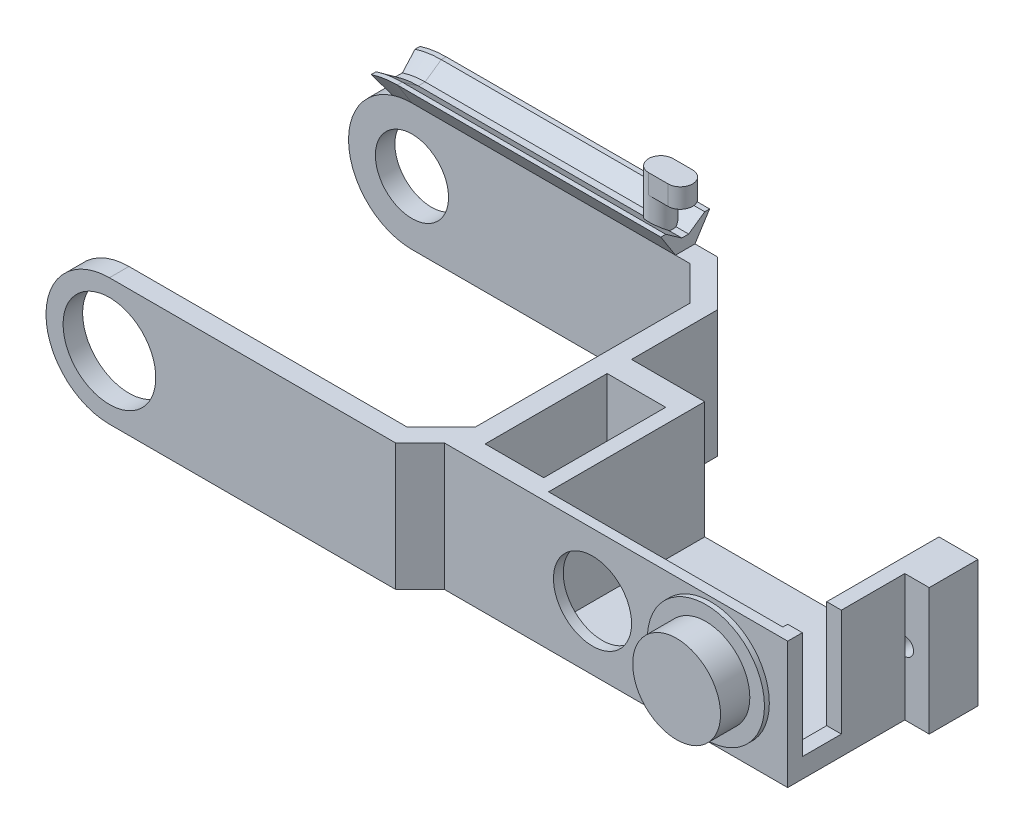
from build123d import *

# Parameters (mm, degrees)
P_IDAT_VYSUNUT_M1_DEPTH  = 13
P_IDAT_VYSUNUT_M2_DEPTH  = 13
SKICA3_W                 = 6
SKICA3_H                 = 12.5
ODEBRAT_VYSUNUT_M1_DEPTH = 44.857724519
SKICA4_W                 = 24
SKICA4_H                 = 16
ODEBRAT_VYSUNUT_M2_DEPTH = 12
SKICA5_R                 = 0.9
ODEBRAT_VYSUNUT_M3_DEPTH = 5
ZAOBLIT1_R               = 6.5
SKICA6_R                 = 3.75
ODEBRAT_VYSUNUT_M4_DEPTH = 5
SKICA7_R                 = 4.75
ODEBRAT_VYSUNUT_M5_DEPTH = 5
SKICA8_W                 = 4
SKICA8_H                 = 11
ODEBRAT_VYSUNUT_M6_DEPTH = 5
SKICA9_R                 = 4
ODEBRAT_VYSUNUT_M7_DEPTH = 10
SKICA10_R                = 6
P_IDAT_VYSUNUT_M3_DEPTH  = 0.5
SKICA11_R                = 4.5
P_IDAT_VYSUNUT_M4_DEPTH  = 3
P_IDAT_VYSUNUT_M5_REACH  = 49.809
P_IDAT_START             = 3
SKICA15_R                = 1.25
P_IDAT_START_2           = 2
P_IDAT_VYSUNUT_M6_DEPTH  = 2


with BuildPart() as part:
    # Skica1 → Přidat vysunutím1 (new body)
    with BuildSketch(Plane(origin=(0, 0, 0), x_dir=(1, 0, 0), z_dir=(0, 1, 0))):
        Polygon((0, -11), (0, 11), (-3.5, 14.5), (-38.5, 14.5), (-38.5, 16.5), (-2.671572875, 16.5), (2, 11.828427125), (2, -11.828427125), (-2.671572875, -16.5), (-38.5, -16.5), (-38.5, -14.5), (-3.5, -14.5), align=None)
    extrude(amount=P_IDAT_VYSUNUT_M1_DEPTH)

    # Skica2 → Přidat vysunutím2 (add)
    with BuildSketch(Plane.XZ):
        Polygon((-0.171572875, 14), (35, 14), (35, 2), (37.5, 2), (37.5, -3), (2, -3), (2, 11.828427125), align=None)
    extrude(amount=-P_IDAT_VYSUNUT_M2_DEPTH)

    # Skica3 → Odebrat vysunutím1 (cut, through all)
    with BuildSketch(Plane(origin=(0, 13, 0), x_dir=(1, 0, 0), z_dir=(0, 1, 0))):
        with Locations((5, -5.75)):
            Rectangle(SKICA3_W, SKICA3_H)
    extrude(amount=-ODEBRAT_VYSUNUT_M1_DEPTH, mode=Mode.SUBTRACT)

    # Skica4 → Odebrat vysunutím2 (cut)
    with BuildSketch(Plane(origin=(0, 13, 0), x_dir=(1, 0, 0), z_dir=(0, 1, 0))):
        with Locations((21.5, -5)):
            Rectangle(SKICA4_W, SKICA4_H)
    extrude(amount=-ODEBRAT_VYSUNUT_M2_DEPTH, mode=Mode.SUBTRACT)

    # Skica5 → Odebrat vysunutím3 (cut)
    with BuildSketch(Plane(origin=(0, 0, -3), x_dir=(-1, 0, 0), z_dir=(0, 0, -1))):
        with Locations((-34.993787626, 6.555058734)):
            Circle(SKICA5_R)
        with Locations((-8.006314188, 6.5550616)):
            Circle(SKICA5_R)
    extrude(amount=-ODEBRAT_VYSUNUT_M3_DEPTH, mode=Mode.SUBTRACT)

    # Zaoblit1
    zaoblit1_edges = [part.edges().sort_by_distance(p)[0] for p in [
        (-38.5, 0, -15.5),
        (-38.5, 13, -15.5),
        (-38.5, 0, 15.5),
        (-38.5, 13, 15.5),
    ]]
    fillet(zaoblit1_edges, radius=ZAOBLIT1_R - 0.0001)  # a hair under: the kernel refuses the full size

    # Skica6 → Odebrat vysunutím4 (cut)
    with BuildSketch(Plane(origin=(0, 0, -16.5), x_dir=(-1, 0, 0), z_dir=(0, 0, -1))):
        with Locations((32, 6.5)):
            Circle(SKICA6_R)
    extrude(amount=-ODEBRAT_VYSUNUT_M4_DEPTH, mode=Mode.SUBTRACT)

    # Skica7 → Odebrat vysunutím5 (cut)
    with BuildSketch(Plane(origin=(0, 0, 14.5), x_dir=(-1, 0, 0), z_dir=(0, 0, -1))):
        with Locations((32, 6.5)):
            Circle(SKICA7_R)
    extrude(amount=-ODEBRAT_VYSUNUT_M5_DEPTH, mode=Mode.SUBTRACT)

    # Skica8 → Odebrat vysunutím6 (cut)
    with BuildSketch(Plane(origin=(35, 0, 0), x_dir=(0, 0, -1), z_dir=(1, 0, 0))):
        with Locations((-10.5, 7.5)):
            Rectangle(SKICA8_W, SKICA8_H)
    extrude(amount=-ODEBRAT_VYSUNUT_M6_DEPTH, mode=Mode.SUBTRACT)

    # Skica9 → Odebrat vysunutím7 (cut)
    with BuildSketch(Plane.XY.offset(14)):
        with Locations((15, 6.554999832)):
            Circle(SKICA9_R)
    extrude(amount=-ODEBRAT_VYSUNUT_M7_DEPTH, mode=Mode.SUBTRACT)

    # Skica10 → Přidat vysunutím3 (add)
    with BuildSketch(Plane.XY.offset(14)):
        with Locations((27.118831388, 6.554999832)):
            Circle(SKICA10_R)
    extrude(amount=P_IDAT_VYSUNUT_M3_DEPTH)

    # Skica11 → Přidat vysunutím4 (add)
    with BuildSketch(Plane.XY.offset(14.5)):
        with Locations((27.118831388, 6.554999832)):
            Circle(SKICA11_R)
    extrude(amount=P_IDAT_VYSUNUT_M4_DEPTH)

    # Táhnout po křivce1: sweep along a path in Skica14
    with BuildLine(Plane(origin=(0, 0, -16.5), x_dir=(-1, 0, 0), z_dir=(0, 0, -1))) as t_hnout_po_k_ivce1_path:
        Line((5, 13), (32, 13))
        ThreePointArc((32, 13), (32.996059893, 12.923228525), (33.968590866, 12.694727597))
    # Skica12 → Táhnout po křivce1 (sweep)
    with BuildSketch(Plane.ZY.offset(5)):
        Polygon((-14.5, 13), (-16.5, 13), (-18, 15.354528366), (-17.5, 15.354528366), (-15.851162616, 14.2), (-15.148837384, 14.2), (-13.5, 15.354528366), (-13, 15.354528366), align=None)
    sweep(path=t_hnout_po_k_ivce1_path.line)

    # Skica15 → Přidat vysunutím5 (add, up to next)
    with BuildSketch(Plane(origin=(0, 14.2, 0), x_dir=(1, 0, 0), z_dir=(0, 1, 0)).offset(P_IDAT_START), mode=Mode.PRIVATE) as p_idat_vysunut_m5_sk1:
        with Locations(Location((-7.5, 15.5, 0), (0, 0, 270))):
            Circle(SKICA15_R)
    p_idat_vysunut_m5_tool1 = extrude(p_idat_vysunut_m5_sk1.sketch, amount=-P_IDAT_VYSUNUT_M5_REACH, mode=Mode.PRIVATE) - part.part
    add(p_idat_vysunut_m5_tool1.solids().sort_by_distance((-7.5, 17.2, -15.5))[0])

    # Skica16 → Přidat vysunutím6 (add)
    with BuildSketch(Plane(origin=(0, 17.2, 0), x_dir=(1, 0, 0), z_dir=(0, 1, 0)).offset(P_IDAT_START_2)):
        with BuildLine():
            Line((-7.5, 16.75), (-5.5, 16.75))
            ThreePointArc((-5.5, 16.75), (-4.25, 15.5), (-5.5, 14.25))
            Line((-5.5, 14.25), (-7.5, 14.25))
            ThreePointArc((-7.5, 14.25), (-8.75, 15.5), (-7.5, 16.75))
        make_face()
    extrude(amount=-P_IDAT_VYSUNUT_M6_DEPTH)


solid = part.part
